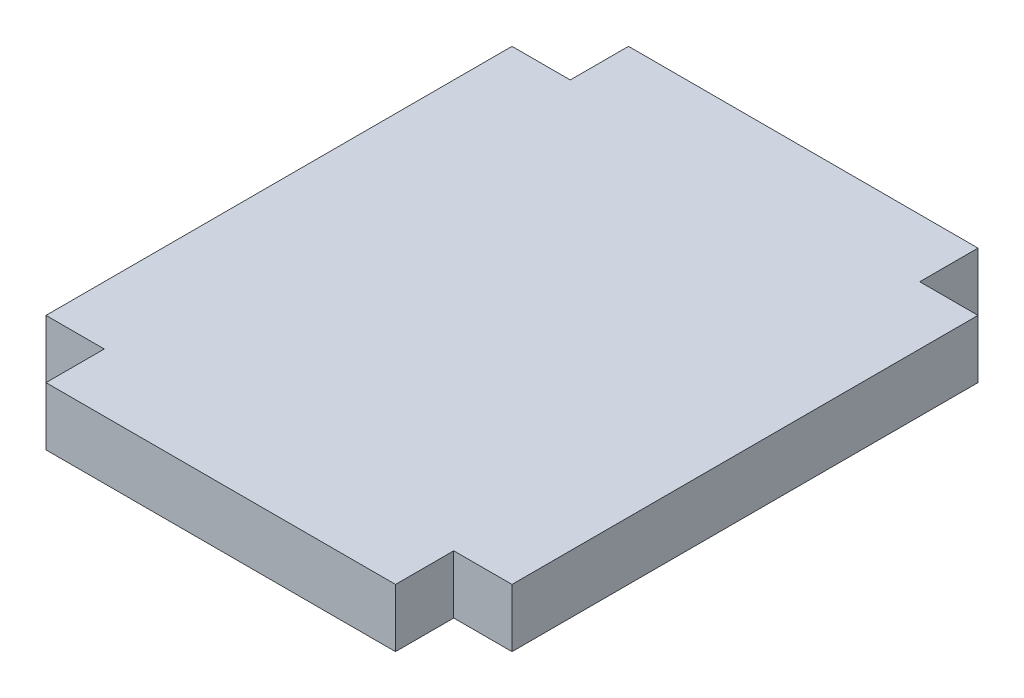
from build123d import *

# Parameters (mm, degrees)
SALIENTE_EXTRUIR1_DEPTH = 3


with BuildPart() as part:
    # Croquis1 → Saliente-Extruir1 (new body)
    with BuildSketch(Plane(origin=(0, 0, 0), x_dir=(1, 0, 0), z_dir=(0, 1, 0))):
        Polygon((0, 3), (0, 0), (18, 0), (18, 3), (21, 3), (21, 27), (18, 27), (18, 30), (0, 30), (0, 27), (-3, 27), (-3, 3), align=None)
    extrude(amount=SALIENTE_EXTRUIR1_DEPTH)


solid = part.part
